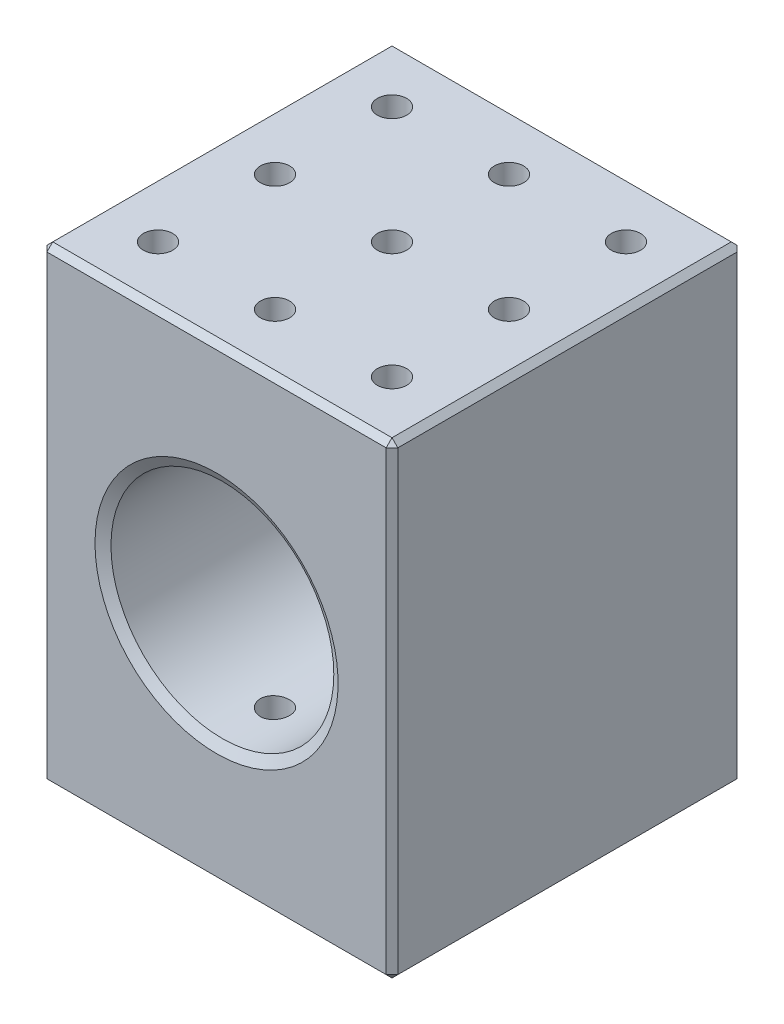
from build123d import *
from OCP.BRepFilletAPI import BRepFilletAPI_MakeChamfer

# Parameters (mm, degrees)
SKETCH1_W                      = 30
SKETCH1_H                      = 40
SKETCH1_R                      = 9.525
BOSS_EXTRUDE1_DEPTH            = 15
CHAMFER2_SIZE                  = 0.5
CHAMFER2_SIZE2                 = 0.866025404
CHAMFER3_SIZE                  = 0.5
M3X0_5_TAPPED_HOLE1_AT_2_COUNT = 2
M3X0_5_TAPPED_HOLE1_AT_2_PITCH = 20
M3X0_5_TAPPED_HOLE1_AT_3_COUNT = 2
M3X0_5_TAPPED_HOLE1_AT_3_PITCH = 10
M3X0_5_TAPPED_HOLE1_AT_4_COUNT = 2
M3X0_5_TAPPED_HOLE1_AT_4_PITCH = 10
M3X0_5_TAPPED_HOLE1_AT_5_COUNT = 2
M3X0_5_TAPPED_HOLE1_AT_5_PITCH = 10
M3X0_5_TAPPED_HOLE1_AT_6_COUNT = 2
M3X0_5_TAPPED_HOLE1_AT_6_PITCH = 22.360679775
M3X0_5_TAPPED_HOLE1_AT_7_COUNT = 2
M3X0_5_TAPPED_HOLE1_AT_7_PITCH = 22.360679775
M3X0_5_TAPPED_HOLE1_AT_8_COUNT = 2
M3X0_5_TAPPED_HOLE1_AT_8_PITCH = 14.142135624
M3X0_5_TAPPED_HOLE1_AT_9_COUNT = 2
M3X0_5_TAPPED_HOLE1_AT_9_PITCH = 14.142135624
CIRPATTERN1_COUNT              = 2


with BuildPart() as part:
    # Sketch1 → Boss-Extrude1 (new, symmetric)
    with BuildSketch(Plane.XY):
        Rectangle(SKETCH1_W, SKETCH1_H)
        Circle(SKETCH1_R, mode=Mode.SUBTRACT)
    extrude(amount=BOSS_EXTRUDE1_DEPTH, both=True)

    # Chamfer2: one chamfer whose edges measure the first distance from different faces: ONE call of the kernel's chamfer builder (chamfer() names one face for all edges)
    chamfer2_edges_1 = [part.edges().sort_by_distance(p)[0] for p in [
        (-9.525, 0, -15),
    ]]
    chamfer2_side_1 = [part.faces().sort_by_distance(p)[0] for p in [
        (0, -19.5, -15),
    ]]
    chamfer2_edges_2 = [part.edges().sort_by_distance(p)[0] for p in [
        (-9.525, 0, 15),
    ]]
    chamfer2_side_2 = [part.faces().sort_by_distance(p)[0] for p in [
        (-9.525, 0, 0),
    ]]
    chamfer2 = BRepFilletAPI_MakeChamfer(part.part.solid().wrapped)
    for e in chamfer2_edges_1:
        chamfer2.Add(CHAMFER2_SIZE, CHAMFER2_SIZE2, e.wrapped, chamfer2_side_1[0].wrapped)  # the first distance lies on this face
    for e in chamfer2_edges_2:
        chamfer2.Add(CHAMFER2_SIZE, CHAMFER2_SIZE2, e.wrapped, chamfer2_side_2[0].wrapped)  # the first distance lies on this face
    add(Compound.cast(chamfer2.Shape()), mode=Mode.REPLACE)

    # Chamfer3
    chamfer3_edges = [part.edges().sort_by_distance(p)[0] for p in [
        (0, 20, -15),
        (0, -20, -15),
    ]]
    chamfer(chamfer3_edges, length=CHAMFER3_SIZE)

    # Sketch8 → M3x0.5 Tapped Hole1 (revolve, cut)
    with BuildSketch(Plane(origin=(-10, 20, 0), x_dir=(0, 0, 1), z_dir=(1, 0, 0))):
        Polygon((0, 0), (0, 12.751075774), (1.25, 12), (1.25, 0), align=None)
    m3x0_5_tapped_hole1 = revolve(axis=Axis((-10, 26.35, 0), (0, -1, 0)), mode=Mode.SUBTRACT)

    # M3x0.5 Tapped Hole1 at 2: M3x0.5 Tapped Hole1 ×2
    with Locations(*[(i * M3X0_5_TAPPED_HOLE1_AT_2_PITCH, 0, 0) for i in range(1, M3X0_5_TAPPED_HOLE1_AT_2_COUNT)]):
        add(m3x0_5_tapped_hole1, mode=Mode.SUBTRACT)

    # M3x0.5 Tapped Hole1 at 3: M3x0.5 Tapped Hole1 ×2
    with Locations(*[(i * M3X0_5_TAPPED_HOLE1_AT_3_PITCH, 0, 0) for i in range(1, M3X0_5_TAPPED_HOLE1_AT_3_COUNT)]):
        add(m3x0_5_tapped_hole1, mode=Mode.SUBTRACT)

    # M3x0.5 Tapped Hole1 at 4: M3x0.5 Tapped Hole1 ×2
    with Locations(*[(0, 0, -i * M3X0_5_TAPPED_HOLE1_AT_4_PITCH) for i in range(1, M3X0_5_TAPPED_HOLE1_AT_4_COUNT)]):
        add(m3x0_5_tapped_hole1, mode=Mode.SUBTRACT)

    # M3x0.5 Tapped Hole1 at 5: M3x0.5 Tapped Hole1 ×2
    with Locations(*[(0, 0, i * M3X0_5_TAPPED_HOLE1_AT_5_PITCH) for i in range(1, M3X0_5_TAPPED_HOLE1_AT_5_COUNT)]):
        add(m3x0_5_tapped_hole1, mode=Mode.SUBTRACT)

    # M3x0.5 Tapped Hole1 at 6: M3x0.5 Tapped Hole1 ×2
    with Locations(*[Vector(0.894427190999916, 0, -0.44721359549995787) * (i * M3X0_5_TAPPED_HOLE1_AT_6_PITCH) for i in range(1, M3X0_5_TAPPED_HOLE1_AT_6_COUNT)]):
        add(m3x0_5_tapped_hole1, mode=Mode.SUBTRACT)

    # M3x0.5 Tapped Hole1 at 7: M3x0.5 Tapped Hole1 ×2
    with Locations(*[Vector(0.8944271909999159, 0, 0.447213595499958) * (i * M3X0_5_TAPPED_HOLE1_AT_7_PITCH) for i in range(1, M3X0_5_TAPPED_HOLE1_AT_7_COUNT)]):
        add(m3x0_5_tapped_hole1, mode=Mode.SUBTRACT)

    # M3x0.5 Tapped Hole1 at 8: M3x0.5 Tapped Hole1 ×2
    with Locations(*[Vector(0.7071067811865476, 0, -0.7071067811865475) * (i * M3X0_5_TAPPED_HOLE1_AT_8_PITCH) for i in range(1, M3X0_5_TAPPED_HOLE1_AT_8_COUNT)]):
        add(m3x0_5_tapped_hole1, mode=Mode.SUBTRACT)

    # M3x0.5 Tapped Hole1 at 9: M3x0.5 Tapped Hole1 ×2
    with Locations(*[Vector(0.7071067811865475, 0, 0.7071067811865476) * (i * M3X0_5_TAPPED_HOLE1_AT_9_PITCH) for i in range(1, M3X0_5_TAPPED_HOLE1_AT_9_COUNT)]):
        add(m3x0_5_tapped_hole1, mode=Mode.SUBTRACT)

    # CirPattern1: M3x0.5 Tapped Hole1 ×2 about axis
    cirpattern1_axis = Axis((0, 0, 15), (0, 0, -1))
    for i in range(1, CIRPATTERN1_COUNT):
        add(m3x0_5_tapped_hole1.rotate(cirpattern1_axis, i * 360 / CIRPATTERN1_COUNT), mode=Mode.SUBTRACT)

    # CirPattern1 copy 1 sketch → CirPattern1 copy 1 (revolve, cut)
    with BuildSketch(Plane(origin=(-10, -20, 0), x_dir=(0, 0, 1), z_dir=(-1, 0, 0))):
        Polygon((0, 0), (0, 12.751075774), (1.25, 12), (1.25, 0), align=None)
    revolve(axis=Axis((-10, -26.35, 0), (0, 1, 0)), mode=Mode.SUBTRACT)

    # CirPattern1 copy 2 sketch → CirPattern1 copy 2 (revolve, cut)
    with BuildSketch(Plane(origin=(0, -20, 0), x_dir=(0, 0, 1), z_dir=(-1, 0, 0))):
        Polygon((0, 0), (0, 12.751075774), (1.25, 12), (1.25, 0), align=None)
    revolve(axis=Axis((0, -26.35, 0), (0, 1, 0)), mode=Mode.SUBTRACT)

    # CirPattern1 copy 3 sketch → CirPattern1 copy 3 (revolve, cut)
    with BuildSketch(Plane(origin=(10, -20, -10), x_dir=(0, 0, 1), z_dir=(-1, 0, 0))):
        Polygon((0, 0), (0, 12.751075774), (1.25, 12), (1.25, 0), align=None)
    revolve(axis=Axis((10, -26.35, -10), (0, 1, 0)), mode=Mode.SUBTRACT)

    # CirPattern1 copy 4 sketch → CirPattern1 copy 4 (revolve, cut)
    with BuildSketch(Plane(origin=(10, -20, 10), x_dir=(0, 0, 1), z_dir=(-1, 0, 0))):
        Polygon((0, 0), (0, 12.751075774), (1.25, 12), (1.25, 0), align=None)
    revolve(axis=Axis((10, -26.35, 10), (0, 1, 0)), mode=Mode.SUBTRACT)

    # CirPattern1 copy 5 sketch → CirPattern1 copy 5 (revolve, cut)
    with BuildSketch(Plane(origin=(-10, -20, -10), x_dir=(0, 0, 1), z_dir=(-1, 0, 0))):
        Polygon((0, 0), (0, 12.751075774), (1.25, 12), (1.25, 0), align=None)
    revolve(axis=Axis((-10, -26.35, -10), (0, 1, 0)), mode=Mode.SUBTRACT)

    # CirPattern1 copy 6 sketch → CirPattern1 copy 6 (revolve, cut)
    with BuildSketch(Plane(origin=(-10, -20, 10), x_dir=(0, 0, 1), z_dir=(-1, 0, 0))):
        Polygon((0, 0), (0, 12.751075774), (1.25, 12), (1.25, 0), align=None)
    revolve(axis=Axis((-10, -26.35, 10), (0, 1, 0)), mode=Mode.SUBTRACT)

    # CirPattern1 copy 7 sketch → CirPattern1 copy 7 (revolve, cut)
    with BuildSketch(Plane(origin=(0, -20, -10), x_dir=(0, 0, 1), z_dir=(-1, 0, 0))):
        Polygon((0, 0), (0, 12.751075774), (1.25, 12), (1.25, 0), align=None)
    revolve(axis=Axis((0, -26.35, -10), (0, 1, 0)), mode=Mode.SUBTRACT)

    # CirPattern1 copy 8 sketch → CirPattern1 copy 8 (revolve, cut)
    with BuildSketch(Plane(origin=(0, -20, 10), x_dir=(0, 0, 1), z_dir=(-1, 0, 0))):
        Polygon((0, 0), (0, 12.751075774), (1.25, 12), (1.25, 0), align=None)
    revolve(axis=Axis((0, -26.35, 10), (0, 1, 0)), mode=Mode.SUBTRACT)

    # Chamfer6
    # the kernel refuses this chamfer: 0.5 mm, written as the material it takes off along each edge
    with BuildSketch(Plane(origin=(14.666666667, -19.666666667, 14.666666667), x_dir=(0.7071067811865475, 0.7071067811865475, 0), z_dir=(0.5773502691896258, -0.5773502691896258, 0.5773502691896258)), Plane(origin=(-14.666666667, -19.666666667, 14.666666667), x_dir=(0, 0.7071067811865475, 0.7071067811865475), z_dir=(-0.5773502691896258, -0.5773502691896258, 0.5773502691896258))) as chamfer6_piece_1:
        Polygon((-0.353553391, -0.204124145), (0.353553391, -0.204124145), (0, 0.40824829), align=None)
    extrude(amount=0.635085296, mode=Mode.SUBTRACT)
    with BuildSketch(Plane(origin=(14.666666667, 19.666666667, 14.666666667), x_dir=(-0.7071067811865475, 0, 0.7071067811865475), z_dir=(0.5773502691896258, 0.5773502691896258, 0.5773502691896258)), Plane(origin=(-14.666666667, 19.666666667, 14.666666667), x_dir=(-0.7071067811865475, 0, -0.7071067811865475), z_dir=(-0.5773502691896258, 0.5773502691896258, 0.5773502691896258))) as chamfer6_piece_2:
        Polygon((-0.353553391, 0.204124145), (0.353553391, 0.204124145), (0, -0.40824829), align=None)
    extrude(amount=0.635085296, mode=Mode.SUBTRACT)
    with BuildSketch(Plane(origin=(15, -20.785841494, -15), x_dir=(0.027495876610585647, 0, 0.9996219169112968), z_dir=(0, 1, 0)), Plane(origin=(-15, 20.785841494, -15), x_dir=(-0.027495876610585647, 0, 0.9996219169112968), z_dir=(0, -1, 0))) as chamfer6_piece_3:
        with BuildLine():
            Line((0.514336598, 0), (-0.028273577, -0.513558897))
            Line((-0.028273577, -0.513558897), (-0.038269797, -0.513283938))
            ThreePointArc((-0.038269797, -0.513283938), (-0.017064614, -0.256698915), (-0.009996219, 0.000274959))
            Line((-0.009996219, 0.000274959), (0.000274959, 0.009996219))
            ThreePointArc((0.000274959, 0.009996219), (0.257248832, 0.002927825), (0.514611556, 0.009996219))
            Line((0.514611556, 0.009996219), (0.514336598, 0))
        make_face()
    extrude(amount=41.571682988, mode=Mode.SUBTRACT)
    with BuildSketch(Plane(origin=(15, -21.285841494, 15), x_dir=(0.027495876610585647, 0, -0.9996219169112968), z_dir=(0, 1, 0))) as chamfer6_piece_4:
        with BuildLine():
            Line((0.514336598, 0), (-0.028273577, 0.513558897))
            Line((-0.028273577, 0.513558897), (-0.038269797, 0.513283938))
            ThreePointArc((-0.038269797, 0.513283938), (-0.017064614, 0.256698915), (-0.009996219, -0.000274959))
            Line((-0.009996219, -0.000274959), (0.000274959, -0.009996219))
            ThreePointArc((0.000274959, -0.009996219), (0.257248832, -0.002927825), (0.514611556, -0.009996219))
            Line((0.514611556, -0.009996219), (0.514336598, 0))
        make_face()
    extrude(amount=42.571682988, mode=Mode.SUBTRACT)
    with BuildSketch(Plane(origin=(15, 20, -15.785841494), x_dir=(0.02749587661058555, -0.9996219169112968, 0), z_dir=(0, 0, 1)), Plane(origin=(-15, 20, 16.285841494), x_dir=(-0.02749587661058555, -0.9996219169112968, 0), z_dir=(0, 0, -1)), Plane(origin=(-15, -20, 16.285841494), x_dir=(0.9996219169112968, -0.0274958766105891, 0), z_dir=(0, 0, -1)), Plane(origin=(15, -20, -15.785841494), x_dir=(-0.9996219169112968, -0.0274958766105891, 0), z_dir=(0, 0, 1))) as chamfer6_piece_5:
        with BuildLine():
            Line((0.514336598, 0), (-0.028273577, -0.513558897))
            Line((-0.028273577, -0.513558897), (-0.038269797, -0.513283938))
            ThreePointArc((-0.038269797, -0.513283938), (-0.017064614, -0.256698915), (-0.009996219, 0.000274959))
            Line((-0.009996219, 0.000274959), (0.000274959, 0.009996219))
            ThreePointArc((0.000274959, 0.009996219), (0.257248832, 0.002927825), (0.514611556, 0.009996219))
            Line((0.514611556, 0.009996219), (0.514336598, 0))
        make_face()
    extrude(amount=32.071682988, mode=Mode.SUBTRACT)
    with BuildSketch(Plane(origin=(16.285841494, 20, 15), x_dir=(0, -0.9996219169112968, 0.02749587661058555), z_dir=(-1, 0, 0))) as chamfer6_piece_6:
        with BuildLine():
            Line((0.514336598, 0), (-0.028273577, -0.513558897))
            Line((-0.028273577, -0.513558897), (-0.038269797, -0.513283938))
            ThreePointArc((-0.038269797, -0.513283938), (-0.017064614, -0.256698915), (-0.009996219, 0.000274959))
            Line((-0.009996219, 0.000274959), (0.000274959, 0.009996219))
            ThreePointArc((0.000274959, 0.009996219), (0.257248832, 0.002927825), (0.514611556, 0.009996219))
            Line((0.514611556, 0.009996219), (0.514336598, 0))
        make_face()
    extrude(amount=32.571682988, mode=Mode.SUBTRACT)
    with BuildSketch(Plane(origin=(-16.285841494, -20, 15), x_dir=(0, -0.0274958766105891, -0.9996219169112968), z_dir=(1, 0, 0))) as chamfer6_piece_7:
        with BuildLine():
            Line((0.514336598, 0), (-0.028273577, 0.513558897))
            Line((-0.028273577, 0.513558897), (-0.038269797, 0.513283938))
            ThreePointArc((-0.038269797, 0.513283938), (-0.017064614, 0.256698915), (-0.009996219, -0.000274959))
            Line((-0.009996219, -0.000274959), (0.000274959, -0.009996219))
            ThreePointArc((0.000274959, -0.009996219), (0.257248832, -0.002927825), (0.514611556, -0.009996219))
            Line((0.514611556, -0.009996219), (0.514336598, 0))
        make_face()
    extrude(amount=32.571682988, mode=Mode.SUBTRACT)
    with BuildSketch(Plane(origin=(-15, 21.285841494, 15), x_dir=(0.9996219169112968, 0, 0.027495876610585647), z_dir=(0, -1, 0))) as chamfer6_piece_8:
        with BuildLine():
            Line((0.514336598, 0), (-0.028273577, -0.513558897))
            Line((-0.028273577, -0.513558897), (-0.038269797, -0.513283938))
            ThreePointArc((-0.038269797, -0.513283938), (-0.017064614, -0.256698915), (-0.009996219, 0.000274959))
            Line((-0.009996219, 0.000274959), (0.000274959, 0.009996219))
            ThreePointArc((0.000274959, 0.009996219), (0.257248832, 0.002927825), (0.514611556, 0.009996219))
            Line((0.514611556, 0.009996219), (0.514336598, 0))
        make_face()
    extrude(amount=42.571682988, mode=Mode.SUBTRACT)


solid = part.part
